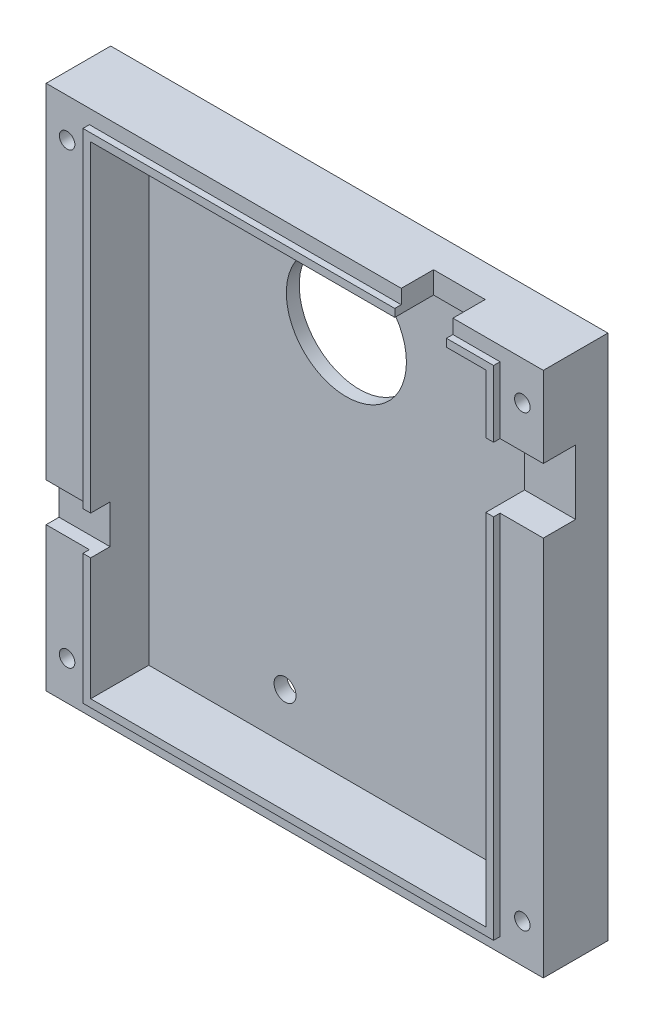
from build123d import *

# Parameters (mm, degrees)
SKETCH1_W            = 81.5
SKETCH1_H            = 77
BOSS_EXTRUDE1_DEPTH  = 2
SKETCH2_W            = 81.5
SKETCH2_H            = 6.7
BOSS_EXTRUDE2_DEPTH  = 8
SKETCH3_W            = 22.3
SKETCH3_H            = 6.7
BOSS_EXTRUDE3_DEPTH  = 10
SKETCH4_W            = 53.2
SKETCH4_H            = 6.7
BOSS_EXTRUDE4_DEPTH  = 10
SKETCH5_W            = 77.1
SKETCH5_H            = 1.2
BOSS_EXTRUDE5_DEPTH  = 8
SKETCH6_W            = 20.1
SKETCH6_H            = 1.2
BOSS_EXTRUDE6_DEPTH  = 11
SKETCH7_W            = 51
SKETCH7_H            = 1.2
BOSS_EXTRUDE7_DEPTH  = 11
SKETCH8_W            = 81.5
SKETCH8_H            = 6.7
BOSS_EXTRUDE8_DEPTH  = 5
SKETCH9_W            = 59
SKETCH9_H            = 6.7
BOSS_EXTRUDE9_DEPTH  = 10
SKETCH10_W           = 12.5
SKETCH10_H           = 6.7
BOSS_EXTRUDE10_DEPTH = 10
SKETCH11_W           = 77.1
SKETCH11_H           = 1.2
BOSS_EXTRUDE11_DEPTH = 5
SKETCH12_W           = 56.8
SKETCH12_H           = 1.2
BOSS_EXTRUDE12_DEPTH = 11
SKETCH13_W           = 10.3
SKETCH13_H           = 1.2
BOSS_EXTRUDE13_DEPTH = 11
SKETCH14_W           = 2.2
SKETCH14_H           = 63.6
BOSS_EXTRUDE14_DEPTH = 10
SKETCH15_W           = 1.2
SKETCH15_H           = 63.6
BOSS_EXTRUDE15_DEPTH = 11
SKETCH16_W           = 2.2
SKETCH16_H           = 63.6
BOSS_EXTRUDE16_DEPTH = 5
SKETCH17_W           = 2.2
SKETCH17_H           = 48.3
BOSS_EXTRUDE17_DEPTH = 10
SKETCH18_W           = 2.2
SKETCH18_H           = 7.3
BOSS_EXTRUDE18_DEPTH = 10
SKETCH19_W           = 1.2
SKETCH19_H           = 63.6
BOSS_EXTRUDE19_DEPTH = 5
SKETCH20_W           = 1.2
SKETCH20_H           = 48.3
BOSS_EXTRUDE20_DEPTH = 11
SKETCH21_W           = 1.2
SKETCH21_H           = 7.3
BOSS_EXTRUDE21_DEPTH = 11
SKETCH22_R           = 1.7
CUT_EXTRUDE1_DEPTH   = 17
SKETCH23_R           = 9.3
CUT_EXTRUDE2_DEPTH   = 17
SKETCH24_R           = 1.2
CUT_EXTRUDE3_DEPTH   = 17
SKETCH25_R           = 2
CUT_EXTRUDE4_DEPTH   = 1
SKETCH26_R           = 1.2
CUT_EXTRUDE5_DEPTH   = 17
SKETCH27_R           = 2
CUT_EXTRUDE6_DEPTH   = 1
SKETCH28_R           = 1.2
CUT_EXTRUDE7_DEPTH   = 17
SKETCH29_R           = 2
CUT_EXTRUDE8_DEPTH   = 1
SKETCH30_R           = 1.2
CUT_EXTRUDE9_DEPTH   = 17
SKETCH31_R           = 2
CUT_EXTRUDE10_DEPTH  = 1


with BuildPart() as part:
    # Sketch1 → Boss-Extrude1 (new body)
    with BuildSketch(Plane(origin=(0, 0, 0), x_dir=(0, 1, 0), z_dir=(0, 0, 1))):
        with Locations((40.75, -38.5)):
            Rectangle(SKETCH1_W, SKETCH1_H)
    extrude(amount=BOSS_EXTRUDE1_DEPTH)

    # Sketch2 → Boss-Extrude2 (add)
    with BuildSketch(Plane(origin=(0, 0, 0), x_dir=(0, 1, 0), z_dir=(0, 0, 1))):
        with Locations((40.75, -3.35)):
            Rectangle(SKETCH2_W, SKETCH2_H)
    extrude(amount=BOSS_EXTRUDE2_DEPTH)

    # Sketch3 → Boss-Extrude3 (add)
    with BuildSketch(Plane(origin=(0, 0, 0), x_dir=(0, 1, 0), z_dir=(0, 0, 1))):
        with Locations((11.15, -3.35)):
            Rectangle(SKETCH3_W, SKETCH3_H)
    extrude(amount=BOSS_EXTRUDE3_DEPTH)

    # Sketch4 → Boss-Extrude4 (add)
    with BuildSketch(Plane(origin=(0, 0, 0), x_dir=(0, 1, 0), z_dir=(0, 0, 1))):
        with Locations((54.9, -3.35)):
            Rectangle(SKETCH4_W, SKETCH4_H)
    extrude(amount=BOSS_EXTRUDE4_DEPTH)

    # Sketch5 → Boss-Extrude5 (add)
    with BuildSketch(Plane(origin=(0, 0, 0), x_dir=(0, 1, 0), z_dir=(0, 0, 1))):
        with Locations((40.75, -7.3)):
            Rectangle(SKETCH5_W, SKETCH5_H)
    extrude(amount=BOSS_EXTRUDE5_DEPTH)

    # Sketch6 → Boss-Extrude6 (add)
    with BuildSketch(Plane(origin=(0, 0, 0), x_dir=(0, 1, 0), z_dir=(0, 0, 1))):
        with Locations((12.25, -7.3)):
            Rectangle(SKETCH6_W, SKETCH6_H)
    extrude(amount=BOSS_EXTRUDE6_DEPTH)

    # Sketch7 → Boss-Extrude7 (add)
    with BuildSketch(Plane(origin=(0, 0, 0), x_dir=(0, 1, 0), z_dir=(0, 0, 1))):
        with Locations((53.8, -7.3)):
            Rectangle(SKETCH7_W, SKETCH7_H)
    extrude(amount=BOSS_EXTRUDE7_DEPTH)

    # Sketch8 → Boss-Extrude8 (add)
    with BuildSketch(Plane(origin=(0, 0, 0), x_dir=(0, 1, 0), z_dir=(0, 0, 1))):
        with Locations((40.75, -73.65)):
            Rectangle(SKETCH8_W, SKETCH8_H)
    extrude(amount=BOSS_EXTRUDE8_DEPTH)

    # Sketch9 → Boss-Extrude9 (add)
    with BuildSketch(Plane(origin=(0, 0, 0), x_dir=(0, 1, 0), z_dir=(0, 0, 1))):
        with Locations((29.5, -73.65)):
            Rectangle(SKETCH9_W, SKETCH9_H)
    extrude(amount=BOSS_EXTRUDE9_DEPTH)

    # Sketch10 → Boss-Extrude10 (add)
    with BuildSketch(Plane(origin=(0, 0, 0), x_dir=(0, 1, 0), z_dir=(0, 0, 1))):
        with Locations((75.25, -73.65)):
            Rectangle(SKETCH10_W, SKETCH10_H)
    extrude(amount=BOSS_EXTRUDE10_DEPTH)

    # Sketch11 → Boss-Extrude11 (add)
    with BuildSketch(Plane(origin=(0, 0, 0), x_dir=(0, 1, 0), z_dir=(0, 0, 1))):
        with Locations((40.75, -69.7)):
            Rectangle(SKETCH11_W, SKETCH11_H)
    extrude(amount=BOSS_EXTRUDE11_DEPTH)

    # Sketch12 → Boss-Extrude12 (add)
    with BuildSketch(Plane(origin=(0, 0, 0), x_dir=(0, 1, 0), z_dir=(0, 0, 1))):
        with Locations((30.6, -69.7)):
            Rectangle(SKETCH12_W, SKETCH12_H)
    extrude(amount=BOSS_EXTRUDE12_DEPTH)

    # Sketch13 → Boss-Extrude13 (add)
    with BuildSketch(Plane(origin=(0, 0, 0), x_dir=(0, 1, 0), z_dir=(0, 0, 1))):
        with Locations((74.15, -69.7)):
            Rectangle(SKETCH13_W, SKETCH13_H)
    extrude(amount=BOSS_EXTRUDE13_DEPTH)

    # Sketch14 → Boss-Extrude14 (add)
    with BuildSketch(Plane(origin=(0, 0, 0), x_dir=(0, 1, 0), z_dir=(0, 0, 1))):
        with Locations((1.1, -38.5)):
            Rectangle(SKETCH14_W, SKETCH14_H)
    extrude(amount=BOSS_EXTRUDE14_DEPTH)

    # Sketch15 → Boss-Extrude15 (add)
    with BuildSketch(Plane(origin=(0, 0, 0), x_dir=(0, 1, 0), z_dir=(0, 0, 1))):
        with Locations((2.8, -38.5)):
            Rectangle(SKETCH15_W, SKETCH15_H)
    extrude(amount=BOSS_EXTRUDE15_DEPTH)

    # Sketch16 → Boss-Extrude16 (add)
    with BuildSketch(Plane(origin=(0, 0, 0), x_dir=(0, 1, 0), z_dir=(0, 0, 1))):
        with Locations((80.4, -38.5)):
            Rectangle(SKETCH16_W, SKETCH16_H)
    extrude(amount=BOSS_EXTRUDE16_DEPTH)

    # Sketch17 → Boss-Extrude17 (add)
    with BuildSketch(Plane(origin=(0, 0, 0), x_dir=(0, 1, 0), z_dir=(0, 0, 1))):
        with Locations((80.4, -30.85)):
            Rectangle(SKETCH17_W, SKETCH17_H)
    extrude(amount=BOSS_EXTRUDE17_DEPTH)

    # Sketch18 → Boss-Extrude18 (add)
    with BuildSketch(Plane(origin=(0, 0, 0), x_dir=(0, 1, 0), z_dir=(0, 0, 1))):
        with Locations((80.4, -66.65)):
            Rectangle(SKETCH18_W, SKETCH18_H)
    extrude(amount=BOSS_EXTRUDE18_DEPTH)

    # Sketch19 → Boss-Extrude19 (add)
    with BuildSketch(Plane(origin=(0, 0, 0), x_dir=(0, 1, 0), z_dir=(0, 0, 1))):
        with Locations((78.7, -38.5)):
            Rectangle(SKETCH19_W, SKETCH19_H)
    extrude(amount=BOSS_EXTRUDE19_DEPTH)

    # Sketch20 → Boss-Extrude20 (add)
    with BuildSketch(Plane(origin=(0, 0, 0), x_dir=(0, 1, 0), z_dir=(0, 0, 1))):
        with Locations((78.7, -30.85)):
            Rectangle(SKETCH20_W, SKETCH20_H)
    extrude(amount=BOSS_EXTRUDE20_DEPTH)

    # Sketch21 → Boss-Extrude21 (add)
    with BuildSketch(Plane(origin=(0, 0, 0), x_dir=(0, 1, 0), z_dir=(0, 0, 1))):
        with Locations((78.7, -66.65)):
            Rectangle(SKETCH21_W, SKETCH21_H)
    extrude(amount=BOSS_EXTRUDE21_DEPTH)

    # Sketch22 → Cut-Extrude1 (cut)
    with BuildSketch(Plane(origin=(0, 0, 0), x_dir=(0, 1, 0), z_dir=(0, 0, 1))):
        with Locations((10.7, -29)):
            Circle(SKETCH22_R)
    extrude(amount=CUT_EXTRUDE1_DEPTH, mode=Mode.SUBTRACT)

    # Sketch23 → Cut-Extrude2 (cut)
    with BuildSketch(Plane(origin=(0, 0, 0), x_dir=(0, 1, 0), z_dir=(0, 0, 1))):
        with Locations((64, -38.5)):
            Circle(SKETCH23_R)
    extrude(amount=CUT_EXTRUDE2_DEPTH, mode=Mode.SUBTRACT)

    # Sketch24 → Cut-Extrude3 (cut)
    with BuildSketch(Plane(origin=(0, 0, 0), x_dir=(0, 1, 0), z_dir=(0, 0, 1))):
        with Locations((6, -3.25)):
            Circle(SKETCH24_R)
    extrude(amount=CUT_EXTRUDE3_DEPTH, mode=Mode.SUBTRACT)

    # Sketch25 → Cut-Extrude4 (cut)
    with BuildSketch(Plane(origin=(0, 0, 0), x_dir=(0, 1, 0), z_dir=(0, 0, 1))):
        with Locations((6, -3.25)):
            Circle(SKETCH25_R)
    extrude(amount=CUT_EXTRUDE4_DEPTH, mode=Mode.SUBTRACT)

    # Sketch26 → Cut-Extrude5 (cut)
    with BuildSketch(Plane(origin=(0, 0, 0), x_dir=(0, 1, 0), z_dir=(0, 0, 1))):
        with Locations((75.5, -3.25)):
            Circle(SKETCH26_R)
    extrude(amount=CUT_EXTRUDE5_DEPTH, mode=Mode.SUBTRACT)

    # Sketch27 → Cut-Extrude6 (cut)
    with BuildSketch(Plane(origin=(0, 0, 0), x_dir=(0, 1, 0), z_dir=(0, 0, 1))):
        with Locations((75.5, -3.25)):
            Circle(SKETCH27_R)
    extrude(amount=CUT_EXTRUDE6_DEPTH, mode=Mode.SUBTRACT)

    # Sketch28 → Cut-Extrude7 (cut)
    with BuildSketch(Plane(origin=(0, 0, 0), x_dir=(0, 1, 0), z_dir=(0, 0, 1))):
        with Locations((6, -73.75)):
            Circle(SKETCH28_R)
    extrude(amount=CUT_EXTRUDE7_DEPTH, mode=Mode.SUBTRACT)

    # Sketch29 → Cut-Extrude8 (cut)
    with BuildSketch(Plane(origin=(0, 0, 0), x_dir=(0, 1, 0), z_dir=(0, 0, 1))):
        with Locations((6, -73.75)):
            Circle(SKETCH29_R)
    extrude(amount=CUT_EXTRUDE8_DEPTH, mode=Mode.SUBTRACT)

    # Sketch30 → Cut-Extrude9 (cut)
    with BuildSketch(Plane(origin=(0, 0, 0), x_dir=(0, 1, 0), z_dir=(0, 0, 1))):
        with Locations((75.5, -73.75)):
            Circle(SKETCH30_R)
    extrude(amount=CUT_EXTRUDE9_DEPTH, mode=Mode.SUBTRACT)

    # Sketch31 → Cut-Extrude10 (cut)
    with BuildSketch(Plane(origin=(0, 0, 0), x_dir=(0, 1, 0), z_dir=(0, 0, 1))):
        with Locations((75.5, -73.75)):
            Circle(SKETCH31_R)
    extrude(amount=CUT_EXTRUDE10_DEPTH, mode=Mode.SUBTRACT)


solid = part.part
